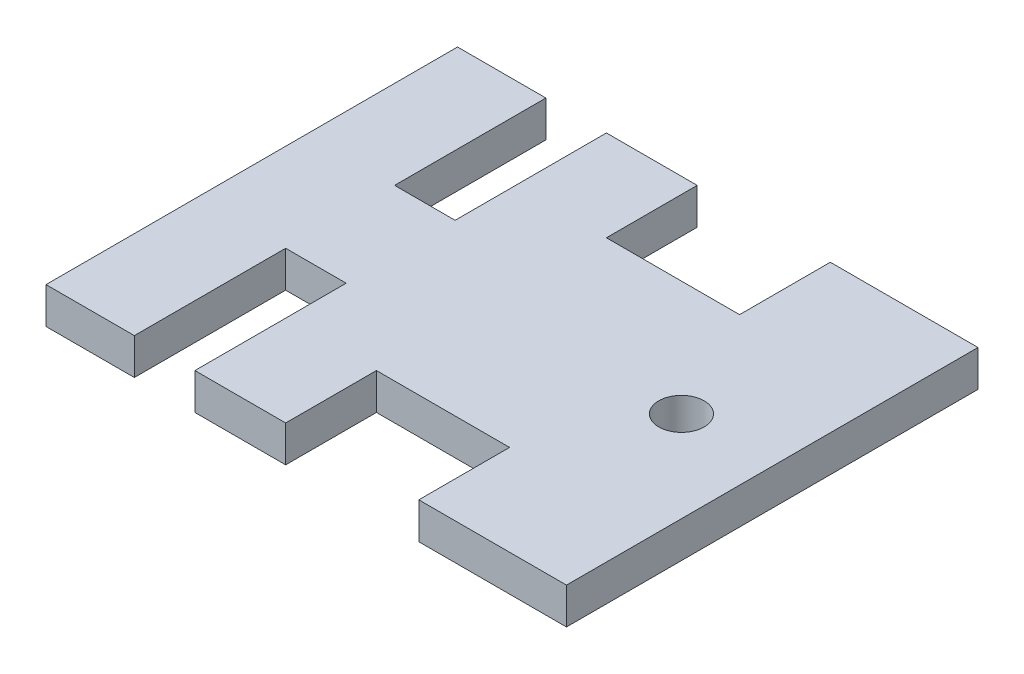
from build123d import *

# Parameters (mm, degrees)
SKETCH1_W                  = 86
SKETCH1_H                  = 68
BOSS_EXTRUDE1_DEPTH        = 6
SKETCH2_W                  = 10
SKETCH2_H                  = 25
SKETCH2_W_2                = 22
SKETCH2_H_2                = 15
CUT_EXTRUDE1_DEPTH         = 110.79981785
F_7_5_7_5_DIAMETER_HOLE1_D = 7.5


with BuildPart() as part:
    # Sketch1 → Boss-Extrude1 (new body)
    with BuildSketch(Plane(origin=(0, 0, 0), x_dir=(1, 0, 0), z_dir=(0, 1, 0))):
        with Locations((43, -34)):
            Rectangle(SKETCH1_W, SKETCH1_H)
    extrude(amount=BOSS_EXTRUDE1_DEPTH)

    # Sketch2 → Cut-Extrude1 (cut, through all)
    with BuildSketch(Plane(origin=(0, 6, 0), x_dir=(1, 0, 0), z_dir=(0, 1, 0))):
        with Locations((19.6, -55.5)):
            Rectangle(SKETCH2_W, SKETCH2_H)
        with Locations((50.6, -60.5)):
            Rectangle(SKETCH2_W_2, SKETCH2_H_2)
    cut_extrude1 = extrude(amount=-CUT_EXTRUDE1_DEPTH, mode=Mode.SUBTRACT)

    # Mirror1: Cut-Extrude1 across plane
    add(cut_extrude1.mirror(Plane.XY.offset(34)), mode=Mode.SUBTRACT)

    # Ø7.5 (7.5) Diameter Hole1 (through all)
    with Locations(Plane(origin=(0, 0, 0), x_dir=(-1, 0, 0), z_dir=(0, -1, 0))):
        with Locations((-71, -34)):
            Hole(F_7_5_7_5_DIAMETER_HOLE1_D / 2)


solid = part.part
